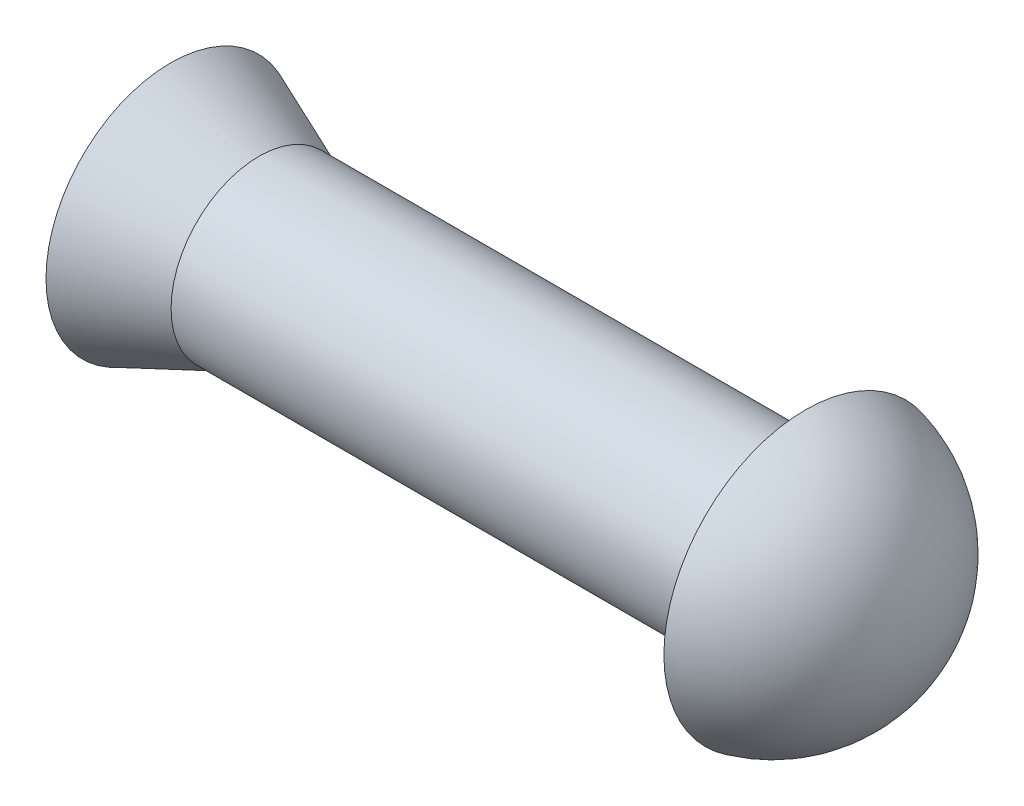
from build123d import *


with BuildPart() as part:
    # Sketch1 → Base-Revolve (revolve)
    with BuildSketch(Plane.XY):
        with BuildLine():
            Line((-131.923380567, 0), (0, 0))
            Line((0, 0), (0, 18))
            Line((0, 18), (-111.893398282, 18))
            Line((-111.893398282, 18), (-130, 25.5))
            ThreePointArc((-130, 25.5), (-131.44185346, 12.786217119), (-131.923380567, 0))
        make_face()
    revolve(axis=Axis((-39, 0, 0), (1, 0, 0)))

    # Sketch2 → HeadTypeA (revolve)
    with BuildSketch(Plane.XY):
        with BuildLine():
            Line((0, 0), (23, 0))
            ThreePointArc((23, 0), (16.551996095, 18.506755523), (0, 29))
            Line((0, 29), (0, 0))
        make_face()
    revolve(axis=Axis((-49, 0, 0), (1, 0, 0)))


solid = part.part
